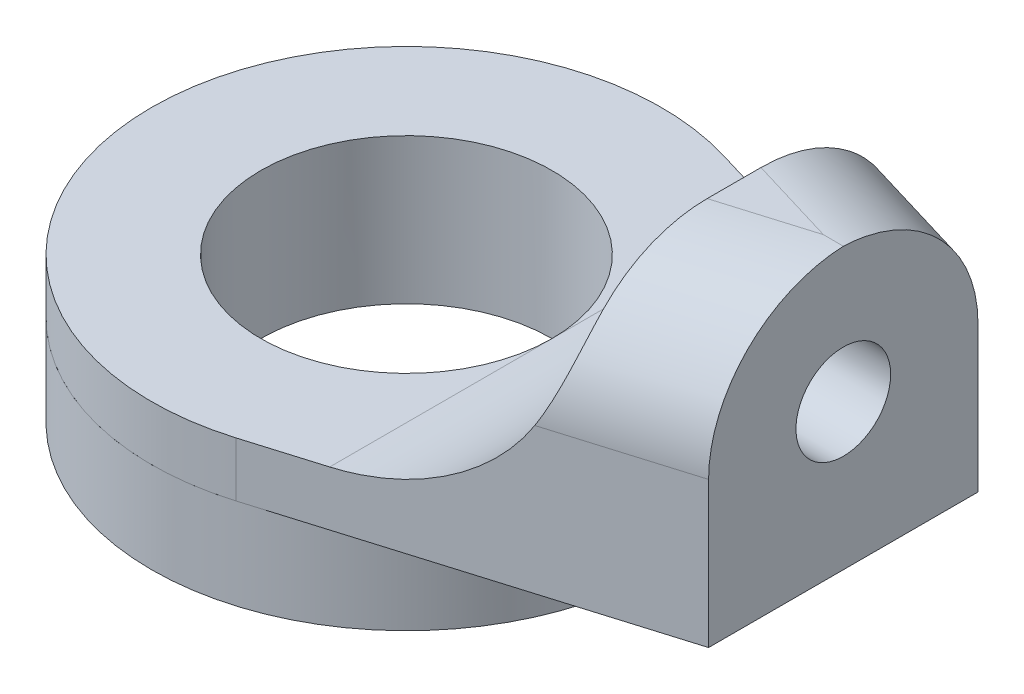
from build123d import *

# Parameters (mm, degrees)
SKETCH_1_R          = 7
EXTRUDE_1_DEPTH     = 1.5
SKETCH_3_R          = 4
CUT_EXTRUDE_2_DEPTH = 11.012492197
EXTRUDE_START       = -1.5
SKETCH_5_R          = 7
EXTRUDE_2_DEPTH     = 1.5
SKETCH_11_R         = 7
SKETCH_11_R_2       = 4
EXTRUDE_4_DEPTH     = 2.5
EXTRUDE_6_DEPTH     = 6.2
FILLET_1_R          = 5
SKETCH_12_R         = 1.3
CUT_EXTRUDE_3_DEPTH = 22.663858813
FILLET_2_R          = 3.7


with BuildPart() as part:
    # Эскиз1 → Бобышка-Вытянуть1 (new body)
    with BuildSketch(Plane(origin=(0, 0, 0), x_dir=(1, 0, 0), z_dir=(0, 1, 0))):
        with Locations(Location((0, 0, 0), (0, 0, 270))):
            Circle(SKETCH_1_R)
    extrude(amount=EXTRUDE_1_DEPTH)

    # Эскиз3 → Вырез-Вытянуть2 (cut, through all)
    with BuildSketch(Plane(origin=(0, 1.5, 0), x_dir=(1, 0, 0), z_dir=(0, 1, 0))):
        with Locations(Location((0, 0, 0), (0, 0, 270))):
            Circle(SKETCH_3_R)
    extrude(amount=-CUT_EXTRUDE_2_DEPTH, mode=Mode.SUBTRACT)

    # Эскиз5 → Бобышка-Вытянуть2 (add)
    with BuildSketch(Plane(origin=(0, 1.5, 0), x_dir=(1, 0, 0), z_dir=(0, 1, 0)).offset(EXTRUDE_START)):
        with BuildLine():
            ThreePointArc((2.017080382, 6.703746112), (-7.000630343, 0), (2.017080382, -6.703746112))
            Line((2.017080382, -6.703746112), (12, -3.7))
            Line((12, -3.7), (12, 3.7))
            Line((12, 3.7), (2.017080382, 6.703746112))
        make_face()
        Circle(SKETCH_5_R, mode=Mode.SUBTRACT)
    extrude(amount=EXTRUDE_2_DEPTH)

    # Эскиз11 → Бобышка-Вытянуть4 (add)
    with BuildSketch(Plane(origin=(0, 0, 0), x_dir=(-1, 0, 0), z_dir=(0, -1, 0))):
        with Locations(Location((0, 0, 0), (0, 0, 270))):
            Circle(SKETCH_11_R)
        with Locations(Location((0, 0, 0), (0, 0, 270))):
            Circle(SKETCH_11_R_2, mode=Mode.SUBTRACT)
    extrude(amount=EXTRUDE_4_DEPTH)

    # Эскиз13 → Бобышка-Вытянуть6 (add)
    with BuildSketch(Plane(origin=(0, 1.5, 0), x_dir=(1, 0, 0), z_dir=(0, 1, 0))):
        Polygon((9, 4.602665621), (9, 0), (9, -4.602665621), (12, -3.7), (12, 3.7), align=None)
    extrude(amount=EXTRUDE_6_DEPTH)

    # Скругление1
    fillet_1_edges = [part.edges().sort_by_distance(p)[0] for p in [
        (9, 1.5, 0),
    ]]
    fillet(fillet_1_edges, radius=FILLET_1_R)

    # Эскиз12 → Вырез-Вытянуть3 (cut, through all)
    with BuildSketch(Plane(origin=(12, 0, 0), x_dir=(0, 0, -1), z_dir=(1, 0, 0))):
        with Locations((0, 4)):
            Circle(SKETCH_12_R)
    extrude(amount=-CUT_EXTRUDE_3_DEPTH, mode=Mode.SUBTRACT)

    # Скругление2
    # the kernel refuses this fillet: 3.7 mm, written as the material it takes off along each edge
    with BuildSketch(Plane(origin=(0.142275982, 7.7, 7.267853272), x_dir=(0, -1, 0), z_dir=(0.9575917857777037, 0, -0.28812839466298473)), Plane(origin=(20.857724018, 7.7, -1.034812349), x_dir=(0, -1, 0), z_dir=(-0.9575917857777037, 0, -0.28812839466298473))) as fillet_2_piece_1:
        with BuildLine():
            CenterArc((FILLET_2_R, FILLET_2_R), FILLET_2_R, 180, 90)
            Line((0, FILLET_2_R), (0, 0))
            Line((0, 0), (FILLET_2_R, 0))
        make_face()
    extrude(amount=21.632858954, mode=Mode.SUBTRACT)


solid = part.part
